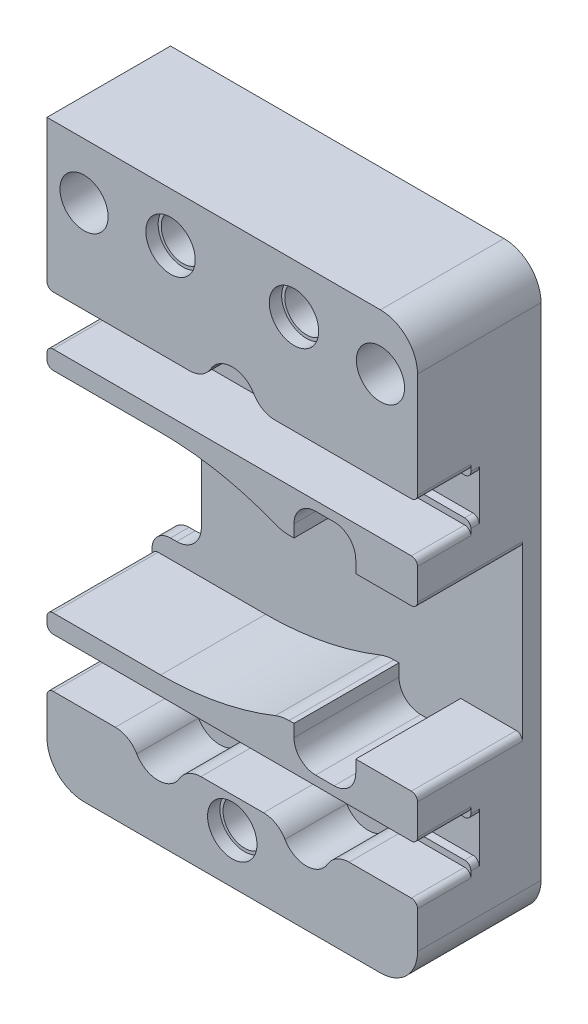
from build123d import *

# Parameters (mm, degrees)
SKETCH6_W           = 30
SKETCH6_H           = 46.5
BOSS_EXTRUDE3_DEPTH = 10
CUT_EXTRUDE2_DEPTH  = 57.233886581
SKETCH9_R           = 1.95
CUT_EXTRUDE4_DEPTH  = 9
FILLET1_R           = 1.5
CUT_EXTRUDE24_DEPTH = 5
FILLET13_R          = 3
CUT_EXTRUDE26_DEPTH = 8.5
FILLET14_R          = 25
SKETCH37_R          = 1.75
CUT_EXTRUDE27_DEPTH = 8.5
SKETCH38_R          = 2
CUT_EXTRUDE28_DEPTH = 1
FILLET15_R          = 0.5
FILLET16_R          = 0.5
FILLET17_R          = 3
SKETCH39_R          = 1.5
CUT_EXTRUDE29_DEPTH = 57.064694773
BOSS_EXTRUDE4_DEPTH = 0.677
FILLET18_R          = 1
FILLET19_R          = 1
FILLET20_R          = 0.5


with BuildPart() as part:
    # Sketch6 → Boss-Extrude3 (new body)
    with BuildSketch(Plane.XY):
        with Locations((-15, 23.25)):
            Rectangle(SKETCH6_W, SKETCH6_H)
    extrude(amount=BOSS_EXTRUDE3_DEPTH)

    # Sketch7 → Cut-Extrude2 (cut, through all)
    with BuildSketch(Plane.XY):
        with BuildLine():
            Line((-50.52729134, 13.5), (-28, 13.5))
            ThreePointArc((-28, 13.5), (-26.585786438, 14.085786438), (-26, 15.5))
            Line((-26, 15.5), (-26, 25.5))
            ThreePointArc((-26, 25.5), (-26.585786438, 26.914213562), (-28, 27.5))
            Line((-28, 27.5), (-50.52729134, 27.5))
            Line((-50.52729134, 27.5), (-50.52729134, 13.5))
        make_face()
    extrude(amount=CUT_EXTRUDE2_DEPTH, mode=Mode.SUBTRACT)

    # Sketch9 → Cut-Extrude4 (cut)
    with BuildSketch(Plane.XY.offset(10)):
        with Locations((-3, 42)):
            Circle(SKETCH9_R)
        with Locations((-27, 42)):
            Circle(SKETCH9_R)
    extrude(amount=-CUT_EXTRUDE4_DEPTH, mode=Mode.SUBTRACT)

    # Fillet1
    fillet1_edges = [part.edges().sort_by_distance(p)[0] for p in [
        (-30, 13.5, 5),
        (-30, 27.5, 5),
    ]]
    fillet(fillet1_edges, radius=FILLET1_R)

    # Sketch33 → Cut-Extrude24 (cut)
    with BuildSketch(Plane.XY.offset(10)):
        with BuildLine():
            Line((0, 34.5), (-11.535898385, 34.5))
            ThreePointArc((-11.535898385, 34.5), (-12.535898385, 34.767949192), (-13.267949192, 35.5))
            ThreePointArc((-13.267949192, 35.5), (-15, 36.5), (-16.732050808, 35.5))
            ThreePointArc((-16.732050808, 35.5), (-17.464101615, 34.767949192), (-18.464101615, 34.5))
            Line((-18.464101615, 34.5), (-30, 34.5))
            Line((-30, 34.5), (-30, 30.5))
            Line((-30, 30.5), (0, 30.5))
            Line((0, 30.5), (0, 34.5))
        make_face()
        with BuildLine():
            Line((-30, 10.5), (-30, 6.5))
            Line((-30, 6.5), (-24.464101615, 6.5))
            ThreePointArc((-24.464101615, 6.5), (-23.464101615, 6.232050808), (-22.732050808, 5.5))
            ThreePointArc((-22.732050808, 5.5), (-21, 4.5), (-19.267949192, 5.5))
            ThreePointArc((-19.267949192, 5.5), (-18.535898385, 6.232050808), (-17.535898385, 6.5))
            Line((-17.535898385, 6.5), (-12.464101615, 6.5))
            ThreePointArc((-12.464101615, 6.5), (-11.464101615, 6.232050808), (-10.732050808, 5.5))
            ThreePointArc((-10.732050808, 5.5), (-9, 4.5), (-7.267949192, 5.5))
            ThreePointArc((-7.267949192, 5.5), (-6.535898385, 6.232050808), (-5.535898385, 6.5))
            Line((-5.535898385, 6.5), (0, 6.5))
            Line((0, 6.5), (0, 10.5))
            Line((0, 10.5), (-30, 10.5))
        make_face()
    extrude(amount=-CUT_EXTRUDE24_DEPTH, mode=Mode.SUBTRACT)

    # Fillet13
    fillet13_edges = [part.edges().sort_by_distance(p)[0] for p in [
        (0, 0, 5),
        (-30, 0, 5),
        (0, 46.5, 5),
    ]]
    fillet(fillet13_edges, radius=FILLET13_R)

    # Sketch36 → Cut-Extrude26 (cut)
    with BuildSketch(Plane.XY.offset(10)):
        with BuildLine():
            Line((-10, 14), (-10, 13))
            ThreePointArc((-10, 13), (-9.487436867, 11.762563133), (-8.25, 11.25))
            Line((-8.25, 11.25), (-6.75, 11.25))
            ThreePointArc((-6.75, 11.25), (-5.512563133, 11.762563133), (-5, 13))
            Line((-5, 13), (-5, 14))
            Line((-5, 14), (0, 14))
            Line((0, 14), (0, 27))
            Line((0, 27), (-5, 27))
            Line((-5, 27), (-5, 28))
            ThreePointArc((-5, 28), (-5.512563133, 29.237436867), (-6.75, 29.75))
            Line((-6.75, 29.75), (-8.25, 29.75))
            ThreePointArc((-8.25, 29.75), (-9.487436867, 29.237436867), (-10, 28))
            Line((-10, 28), (-10, 27))
            Line((-10, 27), (-11, 27))
            Line((-11, 27), (-13, 29))
            Line((-13, 29), (-30, 29))
            Line((-30, 29), (-30, 12))
            Line((-30, 12), (-13, 12))
            Line((-13, 12), (-11, 14))
            Line((-11, 14), (-10, 14))
        make_face()
    extrude(amount=-CUT_EXTRUDE26_DEPTH, mode=Mode.SUBTRACT)

    # Fillet14
    # the kernel refuses this fillet: 25 mm, written as the material it adds along each edge
    with BuildSketch(Plane(origin=(-13, 12, 10), x_dir=(-1, 0, 0), z_dir=(0, 0, -1))) as fillet14_piece_1:
        with BuildLine():
            CenterArc((7.797958971, 25), FILLET14_R, 246.926081934, 23.073918066)
            Line((-2, 2), (-2.195959179, 1.54))
            ThreePointArc((-2.195959179, 1.54), (-1.353553391, 0.646446609), (-0.353553391, -0.353553391))
            Line((-0.353553391, -0.353553391), (0, -0.5))
            Line((0, -0.5), (7.797958971, -0.5))
            Line((7.797958971, -0.5), (7.797958971, 0))
        make_face()
    extrude(amount=8.5)
    with BuildSketch(Plane(origin=(-13, 29, 10), x_dir=(-1, 0, 0), z_dir=(0, 0, -1))) as fillet14_piece_2:
        with BuildLine():
            CenterArc((7.797958971, -25), FILLET14_R, 90, 23.073918066)
            Line((-2, -2), (-2.195959179, -1.54))
            ThreePointArc((-2.195959179, -1.54), (-1.353553391, -0.646446609), (-0.353553391, 0.353553391))
            Line((-0.353553391, 0.353553391), (0, 0.5))
            Line((0, 0.5), (7.797958971, 0.5))
            Line((7.797958971, 0.5), (7.797958971, 0))
        make_face()
    extrude(amount=8.5)

    # Sketch37 → Cut-Extrude27 (cut)
    with BuildSketch(Plane.XY.offset(10)):
        with Locations((-20, 42.5)):
            Circle(SKETCH37_R)
        with Locations((-10, 42.5)):
            Circle(SKETCH37_R)
        with Locations((-15, 4)):
            Circle(SKETCH37_R)
    extrude(amount=-CUT_EXTRUDE27_DEPTH, mode=Mode.SUBTRACT)

    # Sketch38 → Cut-Extrude28 (cut)
    with BuildSketch(Plane.XY.offset(10)):
        with Locations((-20, 42.5)):
            Circle(SKETCH38_R)
        with Locations((-10, 42.5)):
            Circle(SKETCH38_R)
        with Locations((-15, 4)):
            Circle(SKETCH38_R)
    extrude(amount=-CUT_EXTRUDE28_DEPTH, mode=Mode.SUBTRACT)

    # Fillet15
    fillet15_edges = [part.edges().sort_by_distance(p)[0] for p in [
        (0, 34.5, 7.5),
        (0, 30.5, 7.5),
        (-30, 30.5, 7.5),
        (-30, 34.5, 7.5),
        (-30, 10.5, 7.5),
        (0, 10.5, 7.5),
        (0, 6.5, 7.5),
        (-30, 6.5, 7.5),
    ]]
    fillet(fillet15_edges, radius=FILLET15_R)

    # Fillet16
    fillet16_edges = [part.edges().sort_by_distance(p)[0] for p in [
        (0, 27, 5.75),
        (0, 14, 5.75),
        (-30, 29, 5.75),
        (-30, 12, 5.75),
    ]]
    fillet(fillet16_edges, radius=FILLET16_R)

    # Fillet17
    fillet17_edges = [part.edges().sort_by_distance(p)[0] for p in [
        (-11, 27, 5.75),
        (-11, 14, 5.75),
    ]]
    fillet(fillet17_edges, radius=FILLET17_R)

    # Sketch39 → Cut-Extrude29 (cut, through all)
    with BuildSketch(Plane.XY.offset(1)):
        with Locations((-27, 42)):
            Circle(SKETCH39_R)
        with Locations((-3, 42)):
            Circle(SKETCH39_R)
    extrude(amount=-CUT_EXTRUDE29_DEPTH, mode=Mode.SUBTRACT)

    # Sketch40 → Boss-Extrude4 (add)
    with BuildSketch(Plane.XY.offset(5)):
        with BuildLine():
            Line((0, 34), (-5, 34))
            Line((-5, 34), (-5, 34.5))
            Line((-5, 34.5), (-0.5, 34.5))
            ThreePointArc((-0.5, 34.5), (-0.146446609, 34.646446609), (0, 35))
            Line((0, 35), (0, 34))
        make_face()
        with BuildLine():
            Line((-5, 30.5), (-5, 31))
            Line((-5, 31), (0, 31))
            Line((0, 31), (0, 30))
            ThreePointArc((0, 30), (-0.146446609, 30.353553391), (-0.5, 30.5))
            Line((-0.5, 30.5), (-5, 30.5))
        make_face()
        with BuildLine():
            Line((-25, 30.5), (-29.5, 30.5))
            ThreePointArc((-29.5, 30.5), (-29.853553391, 30.353553391), (-30, 30))
            Line((-30, 30), (-30, 31))
            Line((-30, 31), (-25, 31))
            Line((-25, 31), (-25, 30.5))
        make_face()
        with BuildLine():
            Line((-30, 35), (-30, 34))
            Line((-30, 34), (-25, 34))
            Line((-25, 34), (-25, 34.5))
            Line((-25, 34.5), (-29.5, 34.5))
            ThreePointArc((-29.5, 34.5), (-29.853553391, 34.646446609), (-30, 35))
        make_face()
        with BuildLine():
            Line((-5, 10.5), (-0.5, 10.5))
            ThreePointArc((-0.5, 10.5), (-0.146446609, 10.646446609), (0, 11))
            Line((0, 11), (0, 10))
            Line((0, 10), (-5, 10))
            Line((-5, 10), (-5, 10.5))
        make_face()
        with BuildLine():
            Line((0, 6), (0, 7))
            Line((0, 7), (-5, 7))
            Line((-5, 7), (-5, 6.5))
            Line((-5, 6.5), (-0.5, 6.5))
            ThreePointArc((-0.5, 6.5), (-0.146446609, 6.353553391), (0, 6))
        make_face()
        with BuildLine():
            Line((-30, 7), (-25, 7))
            Line((-25, 7), (-25, 6.5))
            Line((-25, 6.5), (-29.5, 6.5))
            ThreePointArc((-29.5, 6.5), (-29.853553391, 6.353553391), (-30, 6))
            Line((-30, 6), (-30, 7))
        make_face()
        with BuildLine():
            Line((-25, 10.5), (-25, 10))
            Line((-25, 10), (-30, 10))
            Line((-30, 10), (-30, 11))
            ThreePointArc((-30, 11), (-29.853553391, 10.646446609), (-29.5, 10.5))
            Line((-29.5, 10.5), (-25, 10.5))
        make_face()
    extrude(amount=BOSS_EXTRUDE4_DEPTH)

    # Fillet18
    # the kernel refuses this fillet: 1 mm, written as the material it adds along each edge
    with BuildSketch(Plane(origin=(-5, 6.5, 3.091529401), x_dir=(0, 1, 0), z_dir=(0, 0, 1))) as fillet18_piece_1:
        with BuildLine():
            CenterArc((0.980548867, 0.87696795), FILLET18_R, 186.528063675, 54.750680775)
            Line((-0.012967422, 0.763278095), (-0.112319051, 0.75190911))
            ThreePointArc((-0.112319051, 0.75190911), (-0.1, 0.535898385), (-0.1, 0))
            Line((-0.1, 0), (0, -0.1))
            ThreePointArc((0, -0.1), (0.25, -0.1), (0.451945113, -0.087696795))
            Line((0.451945113, -0.087696795), (0.5, 0))
        make_face()
    extrude(amount=2.585470599)
    with BuildSketch(Plane(origin=(-5, 10.5, 2.834936491), x_dir=(-1, 0, 0), z_dir=(0, 0, 1)), Plane(origin=(-25, 30.5, 2.834936491), x_dir=(1, 0, 0), z_dir=(0, 0, 1))) as fillet18_piece_2:
        with BuildLine():
            CenterArc((0.866025404, 1), FILLET18_R, 210, 60)
            Line((0, 0.5), (-0.017320508, 0.49))
            ThreePointArc((-0.017320508, 0.49), (-0.02, 0.25), (-0.02, 0))
            Line((-0.02, 0), (0, -0.02))
            Line((0, -0.02), (0.866025404, -0.02))
            Line((0.866025404, -0.02), (0.866025404, 0))
        make_face()
    extrude(amount=2.842063509)
    with BuildSketch(Plane(origin=(-25, 6.5, 3.091529401), x_dir=(0.9998557161664758, -0.016986666807342152, 0), z_dir=(0, 0, 1))) as fillet18_piece_3:
        with BuildLine():
            CenterArc((0.860185161, 0.995304153), FILLET18_R, 209.694566678, 54.750680775)
            Line((-0.008493333, 0.499927858), (-0.095361183, 0.450390229))
            ThreePointArc((-0.095361183, 0.450390229), (-0.104232238, 0.248265262), (-0.099985572, -0.001698667))
            Line((-0.099985572, -0.001698667), (0.001698667, -0.099985572))
            ThreePointArc((0.001698667, -0.099985572), (0.53751973, -0.090882444), (0.753708548, -0.099530415))
            Line((0.753708548, -0.099530415), (0.76338824, 0))
        make_face()
    extrude(amount=2.585470599)
    with BuildSketch(Plane(origin=(-25, 10.5, 2.834936491), x_dir=(1, 0, 0), z_dir=(0, 0, 1)), Plane(origin=(-5, 30.5, 2.834936491), x_dir=(-1, 0, 0), z_dir=(0, 0, 1))) as fillet18_piece_4:
        with BuildLine():
            CenterArc((0.866025404, -1), FILLET18_R, 90, 60)
            Line((0, -0.5), (-0.017320508, -0.49))
            ThreePointArc((-0.017320508, -0.49), (-0.02, -0.25), (-0.02, 0))
            Line((-0.02, 0), (0, 0.02))
            Line((0, 0.02), (0.866025404, 0.02))
            Line((0.866025404, 0.02), (0.866025404, 0))
        make_face()
    extrude(amount=2.842063509)
    with BuildSketch(Plane(origin=(-25, 34.5, 2.834936491), x_dir=(0, -1, 0), z_dir=(0, 0, 1))) as fillet18_piece_5:
        with BuildLine():
            CenterArc((1, 0.866025404), FILLET18_R, 180, 60)
            Line((0, 0.866025404), (-0.02, 0.866025404))
            Line((-0.02, 0.866025404), (-0.02, 0))
            Line((-0.02, 0), (0, -0.02))
            ThreePointArc((0, -0.02), (0.25, -0.02), (0.49, -0.017320508))
            Line((0.49, -0.017320508), (0.5, 0))
        make_face()
    extrude(amount=2.842063509)
    with BuildSketch(Plane(origin=(-5, 34.5, 2.834936491), x_dir=(0, -1, 0), z_dir=(0, 0, 1))) as fillet18_piece_6:
        with BuildLine():
            CenterArc((1, -0.866025404), FILLET18_R, 120, 60)
            Line((0, -0.866025404), (-0.02, -0.866025404))
            Line((-0.02, -0.866025404), (-0.02, 0))
            Line((-0.02, 0), (0, 0.02))
            ThreePointArc((0, 0.02), (0.25, 0.02), (0.49, 0.017320508))
            Line((0.49, 0.017320508), (0.5, 0))
        make_face()
    extrude(amount=2.842063509)

    # Fillet19
    fillet19_edges = [part.edges().sort_by_distance(p)[0] for p in [
        (-5, 34, 5.3385),
        (-5, 31, 5.3385),
        (-25, 31, 5.3385),
        (-25, 34, 5.3385),
        (-5, 10, 5.3385),
        (-5, 7, 5.3385),
        (-25, 7, 5.3385),
        (-25, 10, 5.3385),
    ]]
    fillet(fillet19_edges, radius=FILLET19_R)

    # Fillet20
    fillet20_edges = [part.edges().sort_by_distance(p)[0] for p in [
        (0, 34, 5.3385),
        (0, 31, 5.3385),
        (-30, 31, 5.3385),
        (-30, 34, 5.3385),
        (0, 10, 5.3385),
        (0, 7, 5.3385),
        (-30, 7, 5.3385),
        (-30, 10, 5.3385),
    ]]
    fillet(fillet20_edges, radius=FILLET20_R)


solid = part.part
